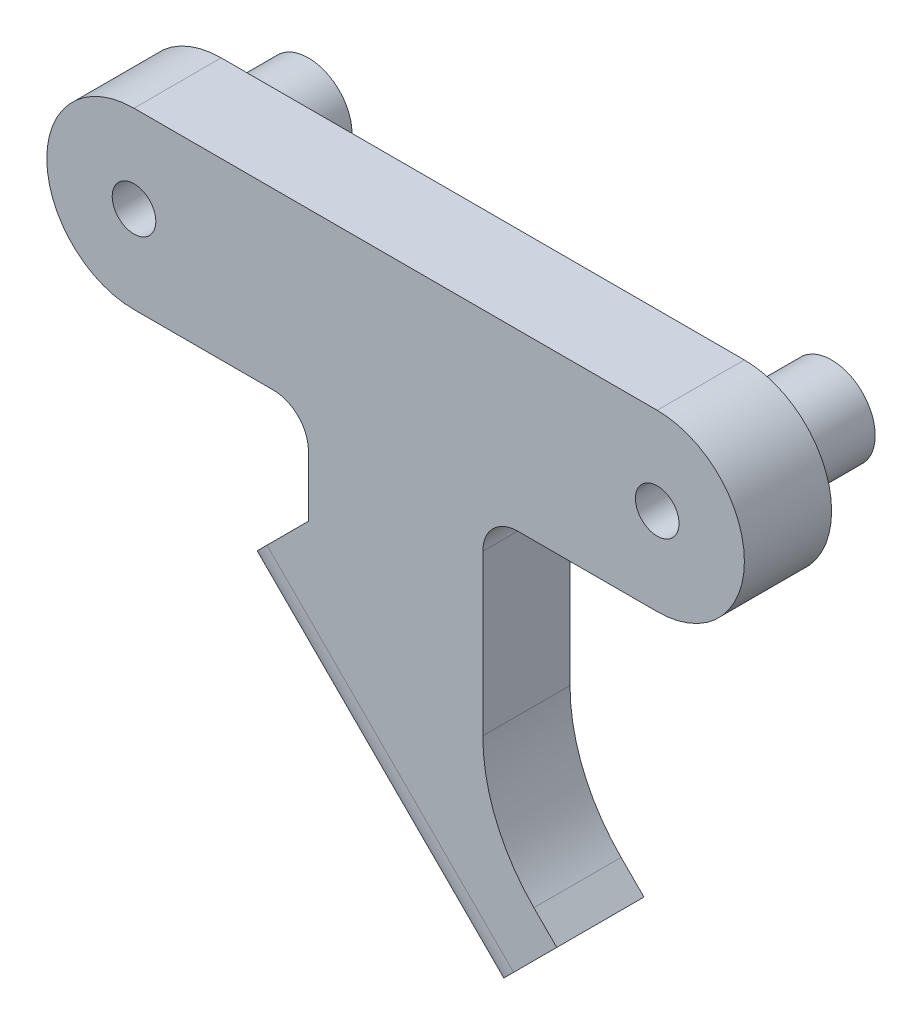
from build123d import *

# Parameters (mm, degrees)
ESTRUSIONE_ESTRUSIONE3_DEPTH = 5
SCHIZZO3_R                   = 2.5
ESTRUSIONE_ESTRUSIONE4_DEPTH = 5
SCHIZZO7_W                   = 5
SCHIZZO7_H                   = 6
ESTRUSIONE_ESTRUSIONE5_DEPTH = 20
SCHIZZO6_R                   = 1.65
TAGLIO_ESTRUSIONE1_DEPTH     = 20
RACCORDO1_R                  = 2.5
SCHIZZO8_R                   = 1.25
TAGLIO_ESTRUSIONE2_DEPTH     = 38.469880381
RACCORDO2_R                  = 2
RACCORDO3_R                  = 10


with BuildPart() as part:
    # Schizzo1 → Estrusione-Estrusione3 (new body)
    with BuildSketch(Plane.XY):
        with BuildLine():
            Line((-13.207991803, 5), (16.792008197, 5))
            ThreePointArc((16.792008197, 5), (21.792008197, 0), (16.792008197, -5))
            Line((16.792008197, -5), (6.792008197, -5))
            Line((6.792008197, -5), (6.792008197, -18.794102079))
            Line((6.792008197, -18.794102079), (6.792008197, -28.794102079))
            Line((6.792008197, -28.794102079), (-3.207991803, -18.794102079))
            Line((-3.207991803, -18.794102079), (-3.207991803, -5))
            Line((-3.207991803, -5), (-13.207991803, -5))
            ThreePointArc((-13.207991803, -5), (-18.207991803, 0), (-13.207991803, 5))
        make_face()
    extrude(amount=ESTRUSIONE_ESTRUSIONE3_DEPTH)

    # Schizzo3 → Estrusione-Estrusione4 (add)
    with BuildSketch(Plane(origin=(0, 0, 0), x_dir=(-1, 0, 0), z_dir=(0, 0, -1))):
        with Locations(Location((-16.792008197, 0, 0), (0, 0, 180))):
            Circle(SCHIZZO3_R)
        with Locations(Location((13.207991803, 0, 0), (0, 0, 180))):
            Circle(SCHIZZO3_R)
    extrude(amount=ESTRUSIONE_ESTRUSIONE4_DEPTH)

    # Schizzo7 → Estrusione-Estrusione5 (add)
    with BuildSketch(Plane(origin=(17.793055138, -17.793055138, 0), x_dir=(0, 0, -1), z_dir=(-0.7071067811865562, 0.7071067811865389, 0))):
        with Locations((-2.5, 12.557829784)):
            Rectangle(SCHIZZO7_W, SCHIZZO7_H)
    extrude(amount=ESTRUSIONE_ESTRUSIONE5_DEPTH)

    # Schizzo6 → Taglio-Estrusione1 (cut)
    with BuildSketch(Plane(origin=(17.793055138, -17.793055138, 0), x_dir=(0, 0, -1), z_dir=(-0.7071067811865562, 0.7071067811865389, 0))):
        with Locations(Location((-2.5, 12.557829784, 0), (0, 0, 270))):
            Circle(SCHIZZO6_R)
    extrude(amount=TAGLIO_ESTRUSIONE1_DEPTH, mode=Mode.SUBTRACT)

    # Raccordo1
    raccordo1_edges = [part.edges().sort_by_distance(p)[0] for p in [
        (-0.279059615, -21.723034267, 0),
        (-0.279059615, -21.723034267, 5),
    ]]
    fillet(raccordo1_edges, radius=RACCORDO1_R - 0.0001)  # a hair under: the kernel refuses the full size

    # Schizzo8 → Taglio-Estrusione2 (cut, through all)
    with BuildSketch(Plane(origin=(0, 0, -5), x_dir=(-1, 0, 0), z_dir=(0, 0, -1))):
        with Locations((-16.792008197, 0)):
            Circle(SCHIZZO8_R)
        with Locations((13.207991803, 0)):
            Circle(SCHIZZO8_R)
    extrude(amount=-TAGLIO_ESTRUSIONE2_DEPTH, mode=Mode.SUBTRACT)

    # Raccordo2
    raccordo2_edges = [part.edges().sort_by_distance(p)[0] for p in [
        (6.792008197, -5, 2.5),
        (-3.207991803, -5, 2.5),
    ]]
    fillet(raccordo2_edges, radius=RACCORDO2_R)

    # Raccordo3
    raccordo3_edges = [part.edges().sort_by_distance(p)[0] for p in [
        (6.792008197, -20.308820704, 2.5),
    ]]
    fillet(raccordo3_edges, radius=RACCORDO3_R)


solid = part.part
